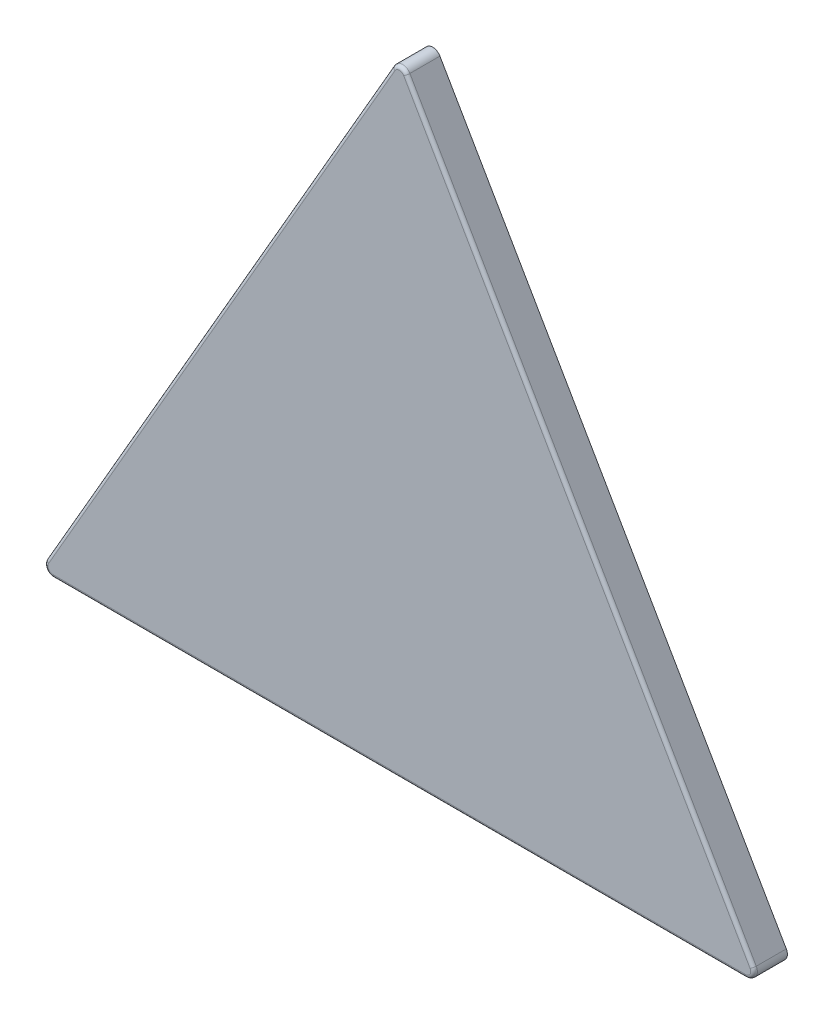
from build123d import *

# Parameters (mm, degrees)
BOSS_EXTRU_1_DEPTH      = 10
ENL_V_MAT_EXTRU_2_DEPTH = 9.4
ENL_V_START             = -0.6
ENL_V_MAT_EXTRU_4_DEPTH = 7
ESQUISSE5_R             = 2.75
ENL_V_MAT_EXTRU_5_DEPTH = 1
CONG_1_R                = 1


with BuildPart() as part:
    # Esquisse1 → Boss.-Extru.1 (new body)
    with BuildSketch(Plane.XY):
        with BuildLine():
            Line((106.137754545, -88.039002148), (2.298008582, 91.816713703))
            ThreePointArc((2.298008582, 91.816713703), (0.132945073, 93.066713703), (-2.032118436, 91.816713703))
            Line((-2.032118436, 91.816713703), (-105.871864399, -88.039002148))
            ThreePointArc((-105.871864399, -88.039002148), (-105.871864399, -90.539002148), (-103.706800889, -91.789002148))
            Line((-103.706800889, -91.789002148), (103.972691035, -91.789002148))
            ThreePointArc((103.972691035, -91.789002148), (106.137754545, -90.539002148), (106.137754545, -88.039002148))
        make_face()
    extrude(amount=BOSS_EXTRU_1_DEPTH)

    # Esquisse2 → Enlèv. mat.-Extru.2 (cut)
    with BuildSketch(Plane(origin=(0, 0, 0), x_dir=(-1, 0, 0), z_dir=(0, 0, -1))):
        with BuildLine():
            Line((-95.745449699, -89.789002148), (95.479559553, -89.789002148))
            ThreePointArc((95.479559553, -89.789002148), (100.026192923, -87.164002148), (100.026192923, -81.914002148))
            Line((100.026192923, -81.914002148), (4.413688297, 83.691713703))
            ThreePointArc((4.413688297, 83.691713703), (-0.132945073, 86.316713703), (-4.679578443, 83.691713703))
            Line((-4.679578443, 83.691713703), (-100.292083069, -81.914002148))
            ThreePointArc((-100.292083069, -81.914002148), (-100.292083069, -87.164002148), (-95.745449699, -89.789002148))
        make_face()
    extrude(amount=-ENL_V_MAT_EXTRU_2_DEPTH, mode=Mode.SUBTRACT)

    # Esquisse4 → Enlèv. mat.-Extru.4 (cut)
    with BuildSketch(Plane.XY.offset(10).offset(ENL_V_START)):
        with BuildLine():
            Line((104.405703737, -89.039002148), (0.565957775, 90.816713703))
            ThreePointArc((0.565957775, 90.816713703), (0.132945073, 91.066713703), (-0.300067629, 90.816713703))
            Line((-0.300067629, 90.816713703), (-104.139813591, -89.039002148))
            ThreePointArc((-104.139813591, -89.039002148), (-104.139813591, -89.539002148), (-103.706800889, -89.789002148))
            Line((-103.706800889, -89.789002148), (103.972691035, -89.789002148))
            ThreePointArc((103.972691035, -89.789002148), (104.405703737, -89.539002148), (104.405703737, -89.039002148))
        make_face()
    extrude(amount=-ENL_V_MAT_EXTRU_4_DEPTH, mode=Mode.SUBTRACT)

    # Esquisse5 → Enlèv. mat.-Extru.5 (cut)
    with BuildSketch(Plane(origin=(0, 0, 0), x_dir=(-1, 0, 0), z_dir=(0, 0, -1))):
        with Locations((-0.132945073, 89.7507822)):
            Circle(ESQUISSE5_R)
        with Locations((103.000183479, -88.881036396)):
            Circle(ESQUISSE5_R)
        with Locations((-103.266073625, -88.881036396)):
            Circle(ESQUISSE5_R)
    extrude(amount=-ENL_V_MAT_EXTRU_5_DEPTH, mode=Mode.SUBTRACT)

    # Congé1
    cong_1_edges = [part.edges().sort_by_distance(p)[0] for p in [
        (0.132945073, -91.789002148, 10),
        (-105.871864399, -90.539002148, 10),
        (-53.951991418, 1.888855778, 10),
        (0.132945073, 93.066713703, 10),
        (54.217881564, 1.888855778, 10),
        (106.137754545, -90.539002148, 10),
    ]]
    fillet(cong_1_edges, radius=CONG_1_R)


solid = part.part
